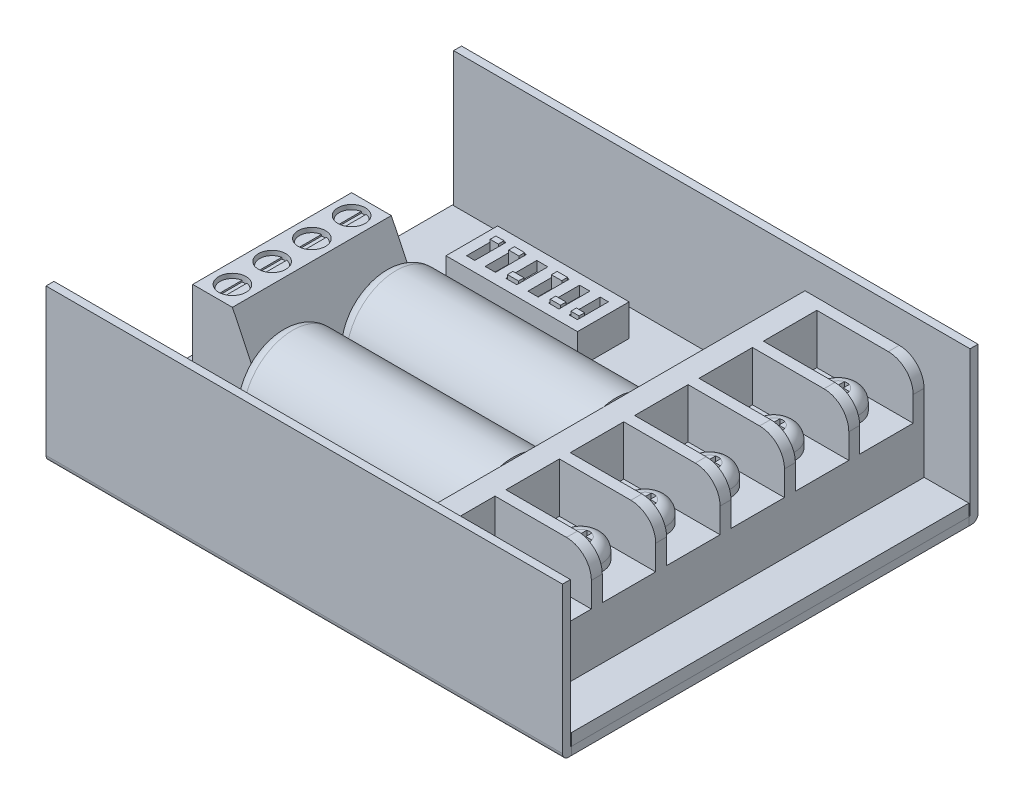
from build123d import *

# Parameters (mm, degrees)
SKETCH1_W              = 66.04
SKETCH1_H              = 50.8
BOSS_EXTRUDE1_DEPTH    = 0.762
SKETCH2_W              = 15.24
SKETCH2_H              = 50.8
BOSS_EXTRUDE2_DEPTH    = 6.6929
SKETCH7_W              = 2.921
SKETCH7_H              = 50.8
BOSS_EXTRUDE4_DEPTH    = 6.35
SKETCH8_W              = 1.397
SKETCH8_H              = 6.35
BOSS_EXTRUDE5_DEPTH    = 12.319
LPATTERN1_COUNT        = 4
LPATTERN1_PITCH        = 8.2296
LPATTERN2_COUNT        = 4
LPATTERN2_PITCH        = 8.2296
FILLET1_R              = 3.175
SKETCH9_W              = 8.509
SKETCH9_H              = 20.32
BOSS_EXTRUDE6_DEPTH    = 10.16
CHAMFER1_SIZE          = 7.112
CHAMFER1_SIZE2         = 3.429
SKETCH10_R             = 6.35
BOSS_EXTRUDE8_DEPTH    = 29.7434
SKETCH11_W             = 16.8148
SKETCH11_H             = 6.604
BOSS_EXTRUDE9_DEPTH    = 4.064
SKETCH12_W             = 1.047432025
SKETCH12_H             = 3.9624
SKETCH12_W_2           = 1.3208
SKETCH12_W_3           = 1.416367975
CUT_EXTRUDE1_DEPTH     = 1.27
SKETCH13_R             = 1.74625
CUT_EXTRUDE2_DEPTH     = 1.27
SKETCH14_R             = 3.2639
BOSS_EXTRUDE10_DEPTH   = 3.81
FILLET3_R              = 1.5875
SKETCH16_W             = 66.04
SKETCH16_H             = 50.8
BOSS_EXTRUDE11_DEPTH   = 1.016
BOSS_EXTRUDE12_DEPTH   = 66.04
FILLET4_R              = 0.09921875
FILLET5_R              = 0.79375
SKETCH22_R             = 2.7178
BOSS_EXTRUDE15_DEPTH   = 2.54
FILLET6_R              = 1.5875
CUT_EXTRUDE4_START     = -3.175
CUT_EXTRUDE4_DEPTH     = 3.175
LPATTERN4_COUNT        = 6
LPATTERN4_PITCH        = 8.2296
SKETCH24_W             = 1.047432025
SKETCH24_H             = 0.73841415
BOSS_EXTRUDE16_DEPTH   = 1.5875
SKETCH24_W_2           = 1.3208
BOSS_EXTRUDE16_2_DEPTH = 1.5875
SKETCH24_W_3           = 1.416367975
SKETCH24_H_2           = 0.710013606
BOSS_EXTRUDE16_3_DEPTH = 1.5875
BOSS_EXTRUDE16_4_DEPTH = 1.5875
BOSS_EXTRUDE16_5_DEPTH = 1.5875
BOSS_EXTRUDE16_6_DEPTH = 1.5875
SKETCH25_R             = 1.5875
BOSS_EXTRUDE17_DEPTH   = 0.79375
SKETCH26_W             = 0.635
SKETCH26_H             = 3.32829629
CUT_EXTRUDE5_DEPTH     = 0.1984375
LPATTERN5_COUNT        = 4
LPATTERN5_PITCH        = 5.08


# Read off the part's stored shape, not the designer's step: Cut-Extrude4
with BuildPart() as part:
    # Sketch1 → Boss-Extrude1 (new, symmetric)
    with BuildSketch(Plane(origin=(0, 0, 0), x_dir=(1, 0, 0), z_dir=(0, 1, 0))):
        Rectangle(SKETCH1_W, SKETCH1_H)
    extrude(amount=BOSS_EXTRUDE1_DEPTH, both=True)

    # Sketch9 → Boss-Extrude6 (add)
    with BuildSketch(Plane(origin=(0, 0.762, 0), x_dir=(1, 0, 0), z_dir=(0, 1, 0))):
        with Locations((-26.416, 0)):
            Rectangle(SKETCH9_W, SKETCH9_H)
    extrude(amount=BOSS_EXTRUDE6_DEPTH)

    # Chamfer1
    chamfer1_edges = [part.edges().sort_by_distance(p)[0] for p in [
        (-22.1615, 10.922, 0),
    ]]
    chamfer1_side = [part.faces().sort_by_distance(p)[0] for p in [
        (-22.1615, 5.842, 0),
    ]]
    chamfer(chamfer1_edges, length=CHAMFER1_SIZE, length2=CHAMFER1_SIZE2, reference=chamfer1_side[0])


with BuildPart() as body_2:
    # Sketch2 → Boss-Extrude2 (new body)
    with BuildSketch(Plane(origin=(0, 0.762, 0), x_dir=(1, 0, 0), z_dir=(0, 1, 0))):
        with Locations((19.685, 0)):
            Rectangle(SKETCH2_W, SKETCH2_H)
    extrude(amount=BOSS_EXTRUDE2_DEPTH)

    # Sketch7 → Boss-Extrude4 (add)
    with BuildSketch(Plane(origin=(0, 7.4549, 0), x_dir=(1, 0, 0), z_dir=(0, 1, 0))):
        with Locations((13.5255, 0)):
            Rectangle(SKETCH7_W, SKETCH7_H)
    extrude(amount=BOSS_EXTRUDE4_DEPTH)

    # Sketch8 → Boss-Extrude5 (add)
    with BuildSketch(Plane(origin=(14.986, 0, 0), x_dir=(0, 0, -1), z_dir=(1, 0, 0))):
        with Locations((0, 10.6299)):
            Rectangle(SKETCH8_W, SKETCH8_H)
    boss_extrude5 = extrude(amount=BOSS_EXTRUDE5_DEPTH)

    # LPattern1: Boss-Extrude5 ×4
    with Locations(*[(0, 0, i * LPATTERN1_PITCH) for i in range(1, LPATTERN1_COUNT)]):
        add(boss_extrude5)

    # LPattern2: Boss-Extrude5 ×4
    with Locations(*[(0, 0, -i * LPATTERN2_PITCH) for i in range(1, LPATTERN2_COUNT)]):
        add(boss_extrude5)

    # Fillet1
    fillet1_edges = [body_2.edges().sort_by_distance(p)[0] for p in [
        (27.305, 13.8049, -24.6888),
        (27.305, 13.8049, 0),
        (27.305, 13.8049, 8.2296),
        (27.305, 13.8049, 16.4592),
        (27.305, 13.8049, 24.6888),
        (27.305, 13.8049, -8.2296),
        (27.305, 13.8049, -16.4592),
    ]]
    fillet(fillet1_edges, radius=FILLET1_R)


    add(part.part)  # Boss-Extrude8 merges part
    # Sketch10 → Boss-Extrude8 (add)
    with BuildSketch(Plane.ZY.offset(-12.065)):
        with Locations(Location((11.938, 7.685002377, 0), (0, 0, 105.471469553))):
            Circle(SKETCH10_R)
        with Locations(Location((-1.27, 7.685002377, 0), (0, 0, 105.471469553))):
            Circle(SKETCH10_R)
    extrude(amount=BOSS_EXTRUDE8_DEPTH)

    # Sketch11 → Boss-Extrude9 (add)
    with BuildSketch(Plane(origin=(0, 0.762, 0), x_dir=(1, 0, 0), z_dir=(0, 1, 0))):
        with Locations((-15.3416, 18.6055)):
            Rectangle(SKETCH11_W, SKETCH11_H)
    extrude(amount=BOSS_EXTRUDE9_DEPTH)

    # Sketch12 → Cut-Extrude1 (cut)
    with BuildSketch(Plane(origin=(0, 4.826, 0), x_dir=(1, 0, 0), z_dir=(0, 1, 0))):
        with Locations((-21.904483988, 18.6055)):
            Rectangle(SKETCH12_W, SKETCH12_H)
        with Locations((-19.399567975, 18.6055)):
            Rectangle(SKETCH12_W_2, SKETCH12_H)
        with Locations((-16.710183988, 18.6055)):
            Rectangle(SKETCH12_W_3, SKETCH12_H)
        with Locations((-13.925232025, 18.6055)):
            Rectangle(SKETCH12_W_2, SKETCH12_H)
        with Locations((-11.283632025, 18.6055)):
            Rectangle(SKETCH12_W_2, SKETCH12_H)
        with Locations((-8.778716013, 18.6055)):
            Rectangle(SKETCH12_W, SKETCH12_H)
    extrude(amount=-CUT_EXTRUDE1_DEPTH, mode=Mode.SUBTRACT)

    # Sketch13 → Cut-Extrude2 (cut)
    with BuildSketch(Plane(origin=(0, 10.922, 0), x_dir=(1, 0, 0), z_dir=(0, 1, 0))):
        with Locations(Location((-28.1305, 7.62, 0), (0, 0, 270))):
            Circle(SKETCH13_R)
        with Locations(Location((-28.1305, 2.54, 0), (0, 0, 270))):
            Circle(SKETCH13_R)
        with Locations(Location((-28.1305, -2.54, 0), (0, 0, 270))):
            Circle(SKETCH13_R)
        with Locations(Location((-28.1305, -7.62, 0), (0, 0, 270))):
            Circle(SKETCH13_R)
    extrude(amount=-CUT_EXTRUDE2_DEPTH, mode=Mode.SUBTRACT)

    # Sketch14 → Boss-Extrude10 (add)
    with BuildSketch(Plane(origin=(0, 0.762, 0), x_dir=(1, 0, 0), z_dir=(0, 1, 0))):
        with Locations(Location((-22.1361, -20.7264, 0), (0, 0, 90))):
            Circle(SKETCH14_R)
        with Locations(Location((-14.1859, -20.7264, 0), (0, 0, 90))):
            Circle(SKETCH14_R)
    extrude(amount=BOSS_EXTRUDE10_DEPTH)

    # Fillet3
    fillet3_edges = [body_2.edges().sort_by_distance(p)[0] for p in [
        (-17.6784, 1.565104755, 13.631916494),
        (-17.6784, 1.565104755, 0.423916494),
    ]]
    fillet(fillet3_edges, radius=FILLET3_R)

    # Sketch22 → Boss-Extrude15 (add)
    with BuildSketch(Plane(origin=(0, 7.4549, 0), x_dir=(1, 0, 0), z_dir=(0, 1, 0))):
        with Locations(Location((21.1455, 20.574, 0), (0, 0, 270))):
            Circle(SKETCH22_R)
        with Locations(Location((21.1455, 12.3444, 0), (0, 0, 270))):
            Circle(SKETCH22_R)
        with Locations(Location((21.1455, 4.1148, 0), (0, 0, 270))):
            Circle(SKETCH22_R)
        with Locations(Location((21.1455, -4.1148, 0), (0, 0, 270))):
            Circle(SKETCH22_R)
        with Locations(Location((21.1455, -12.3444, 0), (0, 0, 270))):
            Circle(SKETCH22_R)
        with Locations(Location((21.1455, -20.574, 0), (0, 0, 270))):
            Circle(SKETCH22_R)
    extrude(amount=BOSS_EXTRUDE15_DEPTH)

    # Fillet6
    fillet6_edges = [body_2.edges().sort_by_distance(p)[0] for p in [
        (21.1455, 9.9949, -23.2918),
        (21.1455, 9.9949, -15.0622),
        (21.1455, 9.9949, -6.8326),
        (21.1455, 9.9949, 1.397),
        (21.1455, 9.9949, 9.6266),
        (21.1455, 9.9949, 17.8562),
    ]]
    fillet(fillet6_edges, radius=FILLET6_R)

    # Cut-Extrude4 outline → Cut-Extrude4 (cut)
    with BuildSketch(Plane(origin=(0, 9.9949, 0), x_dir=(1, 0, 0), z_dir=(0, 1, 0)).offset(CUT_EXTRUDE4_START)):
        with BuildLine():
            ThreePointArc((21.463, -19.48920885), (21.1455, -19.4437), (20.828, -19.48920885))
            Line((20.828, -19.48920885), (20.828, -20.2565))
            Line((20.828, -20.2565), (20.06070885, -20.2565))
            ThreePointArc((20.06070885, -20.2565), (20.0152, -20.574), (20.06070885, -20.8915))
            Line((20.06070885, -20.8915), (20.828, -20.8915))
            Line((20.828, -20.8915), (20.828, -21.65879115))
            ThreePointArc((20.828, -21.65879115), (21.1455, -21.7043), (21.463, -21.65879115))
            Line((21.463, -21.65879115), (21.463, -20.8915))
            Line((21.463, -20.8915), (22.23029115, -20.8915))
            ThreePointArc((22.23029115, -20.8915), (22.2758, -20.574), (22.23029115, -20.2565))
            Line((22.23029115, -20.2565), (21.463, -20.2565))
            Line((21.463, -20.2565), (21.463, -19.48920885))
        make_face()
    cut_extrude4 = extrude(amount=CUT_EXTRUDE4_DEPTH, mode=Mode.SUBTRACT)

    # LPattern4: Cut-Extrude4 ×6
    with Locations(*[(0, 0, -i * LPATTERN4_PITCH) for i in range(1, LPATTERN4_COUNT)]):
        add(cut_extrude4, mode=Mode.SUBTRACT)

    # Sketch25 → Boss-Extrude17 (add)
    with BuildSketch(Plane(origin=(0, 9.652, 0), x_dir=(1, 0, 0), z_dir=(0, 1, 0))):
        with Locations(Location((-28.1305, 7.62, 0), (0, 0, 270))):
            Circle(SKETCH25_R)
    boss_extrude17 = extrude(amount=BOSS_EXTRUDE17_DEPTH)

    # Sketch26 → Cut-Extrude5 (cut)
    with BuildSketch(Plane(origin=(0, 10.44575, 0), x_dir=(1, 0, 0), z_dir=(0, 1, 0))):
        with Locations((-28.1305, 7.62)):
            Rectangle(SKETCH26_W, SKETCH26_H)
    cut_extrude5 = extrude(amount=-CUT_EXTRUDE5_DEPTH, mode=Mode.SUBTRACT)

    # LPattern5: Boss-Extrude17, Cut-Extrude5 ×4
    with Locations(*[(0, 0, i * LPATTERN5_PITCH) for i in range(1, LPATTERN5_COUNT)]):
        add(boss_extrude17)
        add(cut_extrude5, mode=Mode.SUBTRACT)


with BuildPart() as body_2_2:
    # Sketch16 → Boss-Extrude11 (new body)
    with BuildSketch(Plane.XZ.offset(0.762)):
        Rectangle(SKETCH16_W, SKETCH16_H)
    extrude(amount=BOSS_EXTRUDE11_DEPTH)


with BuildPart() as body_3:
    # Sketch17 → Boss-Extrude12 (new body)
    with BuildSketch(Plane.ZY.offset(33.02)):
        Polygon((25.5524, 17.78), (25.5524, -0.762), (25.4, -0.762), (25.4, -1.778), (26.5684, -1.778), (26.5684, 17.78), align=None)
    extrude(amount=-BOSS_EXTRUDE12_DEPTH)

    # Fillet4
    fillet4_edges = [body_3.edges().sort_by_distance(p)[0] for p in [
        (0, -0.762, 25.5524),
    ]]
    fillet(fillet4_edges, radius=FILLET4_R)

    # Fillet5
    fillet5_edges = [body_3.edges().sort_by_distance(p)[0] for p in [
        (0, -1.778, 26.5684),
    ]]
    fillet(fillet5_edges, radius=FILLET5_R)


with BuildPart() as body_4:
    # Mirror5: mirrored copy
    add(body_3.part.mirror(Plane.XY))


with BuildPart() as body_5:
    # Sketch24 → Boss-Extrude16 (new body)
    with BuildSketch(Plane(origin=(0, 3.556, 0), x_dir=(1, 0, 0), z_dir=(0, 1, 0))):
        with Locations((-21.904483988, 19.996582999)):
            Rectangle(SKETCH24_W, SKETCH24_H)
    extrude(amount=BOSS_EXTRUDE16_DEPTH)


with BuildPart() as body_6:
    # Sketch24 → Boss-Extrude16 2 (new body)
    with BuildSketch(Plane(origin=(0, 3.556, 0), x_dir=(1, 0, 0), z_dir=(0, 1, 0))):
        with Locations((-19.399567975, 19.996582999)):
            Rectangle(SKETCH24_W_2, SKETCH24_H)
    extrude(amount=BOSS_EXTRUDE16_2_DEPTH)


with BuildPart() as body_7:
    # Sketch24 → Boss-Extrude16 3 (new body)
    with BuildSketch(Plane(origin=(0, 3.556, 0), x_dir=(1, 0, 0), z_dir=(0, 1, 0))):
        with Locations((-16.710183988, 17.184929122)):
            Rectangle(SKETCH24_W_3, SKETCH24_H_2)
    extrude(amount=BOSS_EXTRUDE16_3_DEPTH)


with BuildPart() as body_8:
    # Sketch24 → Boss-Extrude16 4 (new body)
    with BuildSketch(Plane(origin=(0, 3.556, 0), x_dir=(1, 0, 0), z_dir=(0, 1, 0))):
        with Locations((-13.925232025, 19.996582999)):
            Rectangle(SKETCH24_W_2, SKETCH24_H)
    extrude(amount=BOSS_EXTRUDE16_4_DEPTH)


with BuildPart() as body_9:
    # Sketch24 → Boss-Extrude16 5 (new body)
    with BuildSketch(Plane(origin=(0, 3.556, 0), x_dir=(1, 0, 0), z_dir=(0, 1, 0))):
        with Locations((-11.283632025, 17.184929122)):
            Rectangle(SKETCH24_W_2, SKETCH24_H_2)
    extrude(amount=BOSS_EXTRUDE16_5_DEPTH)


with BuildPart() as body_10:
    # Sketch24 → Boss-Extrude16 6 (new body)
    with BuildSketch(Plane(origin=(0, 3.556, 0), x_dir=(1, 0, 0), z_dir=(0, 1, 0))):
        with Locations((-8.778716013, 17.184929122)):
            Rectangle(SKETCH24_W, SKETCH24_H_2)
    extrude(amount=BOSS_EXTRUDE16_6_DEPTH)


solid = Compound([body_2.part, body_2_2.part, body_3.part, body_4.part, body_5.part, body_6.part, body_7.part, body_8.part, body_9.part, body_10.part])
